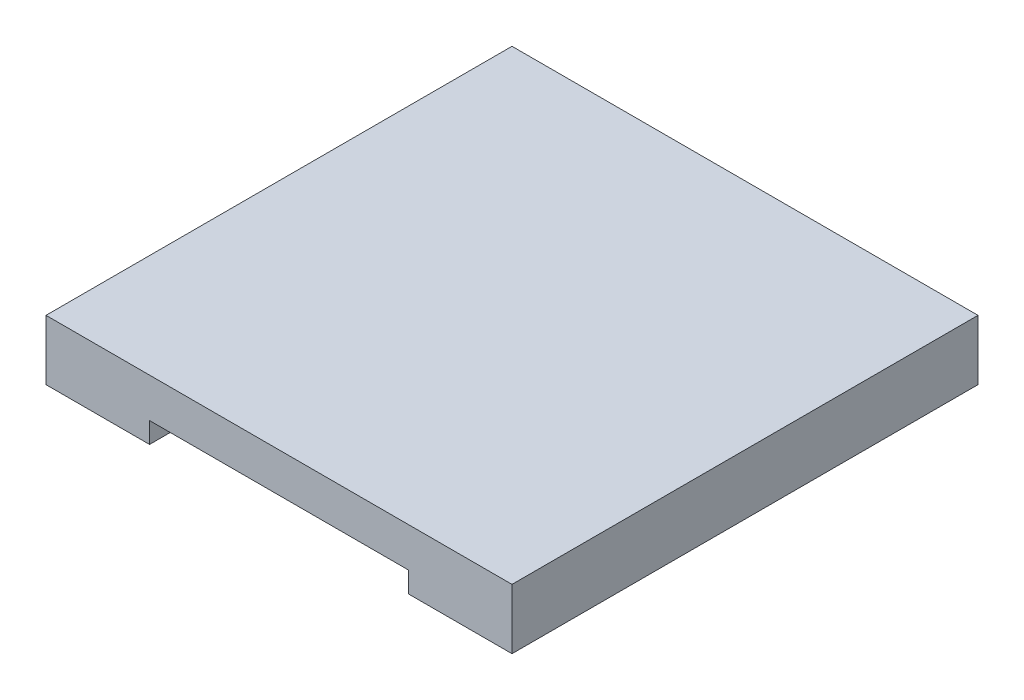
from build123d import *
from OCP.BRepFilletAPI import BRepFilletAPI_MakeChamfer

# Parameters (mm, degrees)
ESQUISSE2_W             = 90
ESQUISSE2_H             = 90
BOSS_EXTRU_1_DEPTH      = 4
ESQUISSE3_W             = 9.2
ESQUISSE3_H             = 10.3
BOSS_EXTRU_2_DEPTH      = 2.4
CONG_1_R                = 1
ESQUISSE5_W             = 14.85
ESQUISSE5_H             = 90
BOSS_EXTRU_3_DEPTH      = 2.4
ESQUISSE6_W             = 7
ESQUISSE6_H             = 5
BOSS_EXTRU_4_DEPTH      = 38
ESQUISSE8_W             = 14.85
ESQUISSE8_H             = 18
BOSS_EXTRU_5_DEPTH      = 38
BOSS_EXTRU_6_REACH      = 97.814
ESQUISSE9_W             = 7
ESQUISSE9_H             = 2
CONG_1_OF_SYM_TRIE1_R   = 1
ENL_V_MAT_EXTRU_1_REACH = 111.983
ESQUISSE10_W            = 2
ESQUISSE10_H            = 18
ENL_V_MAT_EXTRU_2_REACH = 77.38
ESQUISSE11_W            = 40
ESQUISSE11_H            = 18
ESQUISSE12_W            = 5
ESQUISSE12_H            = 8.6
BOSS_EXTRU_7_DEPTH      = 60.3
ESQUISSE13_W            = 6.9
ESQUISSE13_H            = 7.6
BOSS_EXTRU_8_DEPTH      = 2.45
CONG_2_R                = 1
CONG_2_OF_SYM_TRIE2_R   = 1
BOSS_EXTRU_9_DEPTH      = 3
BOSS_EXTRU_9_DEPTH_BACK = 3
ESQUISSE14_W            = 90
ESQUISSE14_H            = 17.8
ESQUISSE15_W            = 15
ESQUISSE15_H            = 17.8
BOSS_EXTRU_10_DEPTH     = 44
ESQUISSE16_W            = 90
ESQUISSE16_H            = 90
BOSS_EXTRU_11_DEPTH     = 11.6
ESQUISSE20_W            = 12
ESQUISSE20_H            = 6.4
BOSS_EXTRU_13_DEPTH     = 10
ESQUISSE21_W            = 12
ESQUISSE21_H            = 6.4
BOSS_EXTRU_14_DEPTH     = 10
CONG_3_R                = 6
ENL_V_MAT_EXTRU_4_REACH = 126.022
ESQUISSE23_R            = 2.3
CONG_3_OF_SYM_TRIE3_R   = 6
ENL_V_MAT_EXTRU_5_REACH = 126.022
ESQUISSE24_R            = 1.75
ENL_V_MAT_EXTRU_6_REACH = 137.909
ESQUISSE26_R            = 1.75
ESQUISSE27_W            = 50
ESQUISSE27_H            = 4
ENL_V_MAT_EXTRU_7_DEPTH = 72.2
CHANFREIN3_SIZE         = 28.5
CHANFREIN3_SIZE2        = 9.5
CHANFREIN4_SIZE         = 10
CHANFREIN4_SIZE2        = 17.5
CHANFREIN8_START        = -45
CHANFREIN8_DEPTH        = 17.8
CHANFREIN9_SIZE         = 3
CHANFREIN9_SIZE_2       = 9
CHANFREIN10_START       = 25.930676813
CHANFREIN10_OUTLINE_W   = 40
CHANFREIN10_OUTLINE_H   = 3.16227766
CHANFREIN10_DEPTH       = 2.069323187
CONG_9_R                = 3
ESQUISSE37_R            = 4
ENL_V_MAT_EXTRU_8_DEPTH = 3
BOSS_EXTRU_15_DEPTH     = 4.8
CONG_11_R               = 3
CHANFREIN14_SIZE        = 10
CHANFREIN14_SIZE2       = 5
ESQUISSE39_W            = 110.537037217
ESQUISSE39_H            = 103.424550411
ENL_V_MAT_EXTRU_9_DEPTH = 79
ESQUISSE40_W            = 8.2
ESQUISSE40_H            = 11.3
BOSS_EXTRU_16_DEPTH     = 15


with BuildPart() as part:
    # Esquisse2 → Boss.-Extru.1 (new body)
    with BuildSketch(Plane(origin=(0, 0, 0), x_dir=(1, 0, 0), z_dir=(0, 1, 0))):
        Rectangle(ESQUISSE2_W, ESQUISSE2_H)
    extrude(amount=BOSS_EXTRU_1_DEPTH)

    # Esquisse3 → Boss.-Extru.2 (add)
    with BuildSketch(Plane(origin=(0, 4, 0), x_dir=(1, 0, 0), z_dir=(0, 1, 0))):
        with Locations((25.55, -6)):
            Rectangle(ESQUISSE3_W, ESQUISSE3_H)
    boss_extru_2 = extrude(amount=BOSS_EXTRU_2_DEPTH)

    # Congé1
    cong_1_edges = [part.edges().sort_by_distance(p)[0] for p in [
        (20.95, 5.2, 0.85),
        (20.95, 5.2, 11.15),
    ]]
    fillet(cong_1_edges, radius=CONG_1_R)

    # Esquisse5 → Boss.-Extru.3 (add)
    with BuildSketch(Plane(origin=(0, 4, 0), x_dir=(1, 0, 0), z_dir=(0, 1, 0))):
        with Locations((37.575, 0)):
            Rectangle(ESQUISSE5_W, ESQUISSE5_H)
    boss_extru_3 = extrude(amount=BOSS_EXTRU_3_DEPTH)

    # Esquisse6 → Boss.-Extru.4 (add)
    with BuildSketch(Plane(origin=(0, 6.4, 0), x_dir=(1, 0, 0), z_dir=(0, 1, 0))):
        with Locations((33.65, -42.5)):
            Rectangle(ESQUISSE6_W, ESQUISSE6_H)
    boss_extru_4 = extrude(amount=BOSS_EXTRU_4_DEPTH)

    # Esquisse8 → Boss.-Extru.5 (add)
    with BuildSketch(Plane(origin=(0, 6.4, 0), x_dir=(1, 0, 0), z_dir=(0, 1, 0))):
        with Locations((37.575, 36)):
            Rectangle(ESQUISSE8_W, ESQUISSE8_H)
    boss_extru_5 = extrude(amount=BOSS_EXTRU_5_DEPTH)

    # Esquisse9 → Boss.-Extru.6 (add, up to next)
    with BuildSketch(Plane.XY.offset(-27), mode=Mode.PRIVATE) as boss_extru_6_sk1:
        with Locations((33.65, 43.4)):
            Rectangle(ESQUISSE9_W, ESQUISSE9_H)
    boss_extru_6_tool1 = extrude(boss_extru_6_sk1.sketch, amount=BOSS_EXTRU_6_REACH, mode=Mode.PRIVATE) - part.part
    boss_extru_6 = boss_extru_6_tool1.solids().sort_by_distance((33.65, 43.4, -27))[0]
    add(boss_extru_6)

    # Symétrie1: Boss.-Extru.2, Boss.-Extru.3, Boss.-Extru.4, Boss.-Extru.5, Boss.-Extru.6 across plane
    add(boss_extru_2.mirror(Plane(origin=(0, 0, 0), x_dir=(0, 0, 1), z_dir=(1, 0, 0))))
    add(boss_extru_3.mirror(Plane(origin=(0, 0, 0), x_dir=(0, 0, 1), z_dir=(1, 0, 0))))
    add(boss_extru_4.mirror(Plane(origin=(0, 0, 0), x_dir=(0, 0, 1), z_dir=(1, 0, 0))))
    add(boss_extru_5.mirror(Plane(origin=(0, 0, 0), x_dir=(0, 0, 1), z_dir=(1, 0, 0))))
    add(boss_extru_6.mirror(Plane(origin=(0, 0, 0), x_dir=(0, 0, 1), z_dir=(1, 0, 0))))

    # Congé1 of Symétrie1
    cong_1_of_sym_trie1_edges = [part.edges().sort_by_distance(p)[0] for p in [
        (-20.95, 5.2, 0.85),
        (-20.95, 5.2, 11.15),
    ]]
    fillet(cong_1_of_sym_trie1_edges, radius=CONG_1_OF_SYM_TRIE1_R)

    # Esquisse10 → Enlèv. mat.-Extru.1 (cut, up to next)
    with BuildSketch(Plane.XY.offset(45), mode=Mode.PRIVATE) as enl_v_mat_extru_1_sk1:
        with Locations((-31.15, 26.85)):
            Rectangle(ESQUISSE10_W, ESQUISSE10_H)
    enl_v_mat_extru_1_tool1 = extrude(enl_v_mat_extru_1_sk1.sketch, amount=-ENL_V_MAT_EXTRU_1_REACH, mode=Mode.PRIVATE) & part.part
    add(enl_v_mat_extru_1_tool1.solids().sort_by_distance((-31.15, 26.85, 45))[0], mode=Mode.SUBTRACT)

    # Esquisse11 → Enlèv. mat.-Extru.2 (cut, up to next)
    with BuildSketch(Plane(origin=(0, 4, 0), x_dir=(1, 0, 0), z_dir=(0, 1, 0)), mode=Mode.PRIVATE) as enl_v_mat_extru_2_sk1:
        with Locations((0, 36)):
            Rectangle(ESQUISSE11_W, ESQUISSE11_H)
    enl_v_mat_extru_2_tool1 = extrude(enl_v_mat_extru_2_sk1.sketch, amount=-ENL_V_MAT_EXTRU_2_REACH, mode=Mode.PRIVATE) & part.part
    add(enl_v_mat_extru_2_tool1.solids().sort_by_distance((0, 4, -36))[0], mode=Mode.SUBTRACT)

    # Esquisse12 → Boss.-Extru.7 (add)
    with BuildSketch(Plane(origin=(-30.15, 0, 0), x_dir=(0, 0, -1), z_dir=(1, 0, 0))):
        with Locations((29.5, 29.34)):
            Rectangle(ESQUISSE12_W, ESQUISSE12_H)
    extrude(amount=BOSS_EXTRU_7_DEPTH)

    # Esquisse13 → Boss.-Extru.8 (add)
    with BuildSketch(Plane.XY.offset(-27)):
        with Locations((24.4, 29.84)):
            Rectangle(ESQUISSE13_W, ESQUISSE13_H)
    boss_extru_8 = extrude(amount=BOSS_EXTRU_8_DEPTH)

    # Congé2
    cong_2_edges = [part.edges().sort_by_distance(p)[0] for p in [
        (20.95, 33.64, -25.775),
        (20.95, 26.04, -25.775),
    ]]
    fillet(cong_2_edges, radius=CONG_2_R)

    # Symétrie2: Boss.-Extru.8 across plane
    add(boss_extru_8.mirror(Plane(origin=(0, 0, 0), x_dir=(0, 0, 1), z_dir=(1, 0, 0))))

    # Congé2 of Symétrie2
    cong_2_of_sym_trie2_edges = [part.edges().sort_by_distance(p)[0] for p in [
        (-20.95, 33.64, -25.775),
        (-20.95, 26.04, -25.775),
    ]]
    fillet(cong_2_of_sym_trie2_edges, radius=CONG_2_OF_SYM_TRIE2_R)

    # Esquisse14 → Boss.-Extru.9 (add, two sides: drawn at the far end of the back side and taken through both)
    with BuildSketch(Plane(origin=(0, 44.4, 0), x_dir=(1, 0, 0), z_dir=(0, 1, 0)).offset(-BOSS_EXTRU_9_DEPTH_BACK)):
        with Locations((0, 36.1)):
            Rectangle(ESQUISSE14_W, ESQUISSE14_H)
    extrude(amount=BOSS_EXTRU_9_DEPTH + BOSS_EXTRU_9_DEPTH_BACK)

    # Esquisse15 → Boss.-Extru.10 (add)
    with BuildSketch(Plane(origin=(0, 47.4, 0), x_dir=(1, 0, 0), z_dir=(0, 1, 0))):
        with Locations((0, 36.1)):
            Rectangle(ESQUISSE15_W, ESQUISSE15_H)
    extrude(amount=BOSS_EXTRU_10_DEPTH)

    # Esquisse16 → Boss.-Extru.11 (add)
    with BuildSketch(Plane(origin=(0, 91.4, 0), x_dir=(1, 0, 0), z_dir=(0, 1, 0))):
        Rectangle(ESQUISSE16_W, ESQUISSE16_H)
    extrude(amount=BOSS_EXTRU_11_DEPTH)

    # Esquisse20 → Boss.-Extru.13 (add)
    with BuildSketch(Plane(origin=(45, 0, 0), x_dir=(0, 0, -1), z_dir=(1, 0, 0))):
        with Locations((-11, 3.2)):
            Rectangle(ESQUISSE20_W, ESQUISSE20_H)
    boss_extru_13 = extrude(amount=BOSS_EXTRU_13_DEPTH)

    # Esquisse21 → Boss.-Extru.14 (add)
    with BuildSketch(Plane(origin=(0, 0, -45), x_dir=(-1, 0, 0), z_dir=(0, 0, -1))):
        with Locations((-39, 3.2)):
            Rectangle(ESQUISSE21_W, ESQUISSE21_H)
    boss_extru_14 = extrude(amount=BOSS_EXTRU_14_DEPTH)

    # Congé3
    cong_3_edges = [part.edges().sort_by_distance(p)[0] for p in [
        (33, 3.2, -55),
        (45, 3.2, -55),
        (55, 3.2, 5),
        (55, 3.2, 17),
    ]]
    fillet(cong_3_edges, radius=CONG_3_R - 0.0001)  # a hair under: the kernel refuses the full size

    # Esquisse23 → Enlèv. mat.-Extru.4 (cut, up to next)
    with BuildSketch(Plane(origin=(0, 6.4, 0), x_dir=(1, 0, 0), z_dir=(0, 1, 0)), mode=Mode.PRIVATE) as enl_v_mat_extru_4_sk1:
        with Locations(Location((50, -11, 0), (0, 0, 270))):
            Circle(ESQUISSE23_R)
    enl_v_mat_extru_4_tool1 = extrude(enl_v_mat_extru_4_sk1.sketch, amount=-ENL_V_MAT_EXTRU_4_REACH, mode=Mode.PRIVATE) & part.part
    # Esquisse23 → Enlèv. mat.-Extru.4 (cut, up to next)
    with BuildSketch(Plane(origin=(0, 6.4, 0), x_dir=(1, 0, 0), z_dir=(0, 1, 0)), mode=Mode.PRIVATE) as enl_v_mat_extru_4_sk2:
        with Locations(Location((39, 50, 0), (0, 0, 270))):
            Circle(ESQUISSE23_R)
    enl_v_mat_extru_4_tool2 = extrude(enl_v_mat_extru_4_sk2.sketch, amount=-ENL_V_MAT_EXTRU_4_REACH, mode=Mode.PRIVATE) & part.part
    enl_v_mat_extru_4_1 = enl_v_mat_extru_4_tool1.solids().sort_by_distance((50, 6.4, 11))[0]
    add(enl_v_mat_extru_4_1, mode=Mode.SUBTRACT)
    enl_v_mat_extru_4_2 = enl_v_mat_extru_4_tool2.solids().sort_by_distance((39, 6.4, -50))[0]
    add(enl_v_mat_extru_4_2, mode=Mode.SUBTRACT)
    enl_v_mat_extru_4 = enl_v_mat_extru_4_1 + enl_v_mat_extru_4_2  # Enlèv. mat.-Extru.4 as one shape, for the pattern or mirror that repeats it

    # Symétrie3: Boss.-Extru.13, Boss.-Extru.14, Enlèv. mat.-Extru.4 across plane
    add(boss_extru_13.mirror(Plane(origin=(0, 0, 0), x_dir=(0, 0, 1), z_dir=(1, 0, 0))))
    add(boss_extru_14.mirror(Plane(origin=(0, 0, 0), x_dir=(0, 0, 1), z_dir=(1, 0, 0))))
    add(enl_v_mat_extru_4.mirror(Plane(origin=(0, 0, 0), x_dir=(0, 0, 1), z_dir=(1, 0, 0))), mode=Mode.SUBTRACT)

    # Congé3 of Symétrie3
    cong_3_of_sym_trie3_edges = [part.edges().sort_by_distance(p)[0] for p in [
        (-33, 3.2, -55),
        (-45, 3.2, -55),
        (-55, 3.2, 5),
        (-55, 3.2, 17),
    ]]
    fillet(cong_3_of_sym_trie3_edges, radius=CONG_3_OF_SYM_TRIE3_R - 0.0001)  # a hair under: the kernel refuses the full size

    # Esquisse24 → Enlèv. mat.-Extru.5 (cut, up to next)
    with BuildSketch(Plane(origin=(0, 6.4, 0), x_dir=(1, 0, 0), z_dir=(0, 1, 0)), mode=Mode.PRIVATE) as enl_v_mat_extru_5_sk1:
        with Locations(Location((25.45, -6, 0), (0, 0, 270))):
            Circle(ESQUISSE24_R)
    enl_v_mat_extru_5_tool1 = extrude(enl_v_mat_extru_5_sk1.sketch, amount=-ENL_V_MAT_EXTRU_5_REACH, mode=Mode.PRIVATE) & part.part
    enl_v_mat_extru_5 = enl_v_mat_extru_5_tool1.solids().sort_by_distance((25.45, 6.4, 6))[0]
    add(enl_v_mat_extru_5, mode=Mode.SUBTRACT)

    # Esquisse26 → Enlèv. mat.-Extru.6 (cut, up to next)
    with BuildSketch(Plane.XY.offset(-24.55), mode=Mode.PRIVATE) as enl_v_mat_extru_6_sk1:
        with Locations((25.55, 28.44)):
            Circle(ESQUISSE26_R)
    enl_v_mat_extru_6_tool1 = extrude(enl_v_mat_extru_6_sk1.sketch, amount=-ENL_V_MAT_EXTRU_6_REACH, mode=Mode.PRIVATE) & part.part
    enl_v_mat_extru_6 = enl_v_mat_extru_6_tool1.solids().sort_by_distance((25.55, 28.44, -24.55))[0]
    add(enl_v_mat_extru_6, mode=Mode.SUBTRACT)

    # Symétrie5: Enlèv. mat.-Extru.5, Enlèv. mat.-Extru.6 across plane
    add(enl_v_mat_extru_5.mirror(Plane(origin=(0, 0, 0), x_dir=(0, 0, 1), z_dir=(1, 0, 0))), mode=Mode.SUBTRACT)
    add(enl_v_mat_extru_6.mirror(Plane(origin=(0, 0, 0), x_dir=(0, 0, 1), z_dir=(1, 0, 0))), mode=Mode.SUBTRACT)

    # Esquisse27 → Enlèv. mat.-Extru.7 (cut)
    with BuildSketch(Plane.XY.offset(45)):
        with Locations((0, 93.4)):
            Rectangle(ESQUISSE27_W, ESQUISSE27_H)
    extrude(amount=-ENL_V_MAT_EXTRU_7_DEPTH, mode=Mode.SUBTRACT)

    # Chanfrein3: one chamfer whose edges measure the first distance from different faces: ONE call of the kernel's chamfer builder (chamfer() names one face for all edges)
    chanfrein3_edges_1 = [part.edges().sort_by_distance(p)[0] for p in [
        (-7.5, 47.4, -36.1),
    ]]
    chanfrein3_side_1 = [part.faces().sort_by_distance(p)[0] for p in [
        (-26.25, 47.4, -36.1),
    ]]
    chanfrein3_edges_2 = [part.edges().sort_by_distance(p)[0] for p in [
        (7.5, 47.4, -36.1),
    ]]
    chanfrein3_side_2 = [part.faces().sort_by_distance(p)[0] for p in [
        (26.25, 47.4, -36.1),
    ]]
    chanfrein3 = BRepFilletAPI_MakeChamfer(part.part.solid().wrapped)
    for e in chanfrein3_edges_1:
        chanfrein3.Add(CHANFREIN3_SIZE, CHANFREIN3_SIZE2, e.wrapped, chanfrein3_side_1[0].wrapped)  # the first distance lies on this face
    for e in chanfrein3_edges_2:
        chanfrein3.Add(CHANFREIN3_SIZE, CHANFREIN3_SIZE2, e.wrapped, chanfrein3_side_2[0].wrapped)  # the first distance lies on this face
    add(Compound.cast(chanfrein3.Shape()), mode=Mode.REPLACE)

    # Chanfrein4: one chamfer whose edges measure the first distance from different faces: ONE call of the kernel's chamfer builder (chamfer() names one face for all edges)
    chanfrein4_edges_1 = [part.edges().sort_by_distance(p)[0] for p in [
        (7.5, 91.4, -36.1),
    ]]
    chanfrein4_side_1 = [part.faces().sort_by_distance(p)[0] for p in [
        (7.5, 74.15, -36.1),
    ]]
    chanfrein4_edges_2 = [part.edges().sort_by_distance(p)[0] for p in [
        (-7.5, 91.4, -36.1),
    ]]
    chanfrein4_side_2 = [part.faces().sort_by_distance(p)[0] for p in [
        (-7.5, 74.15, -36.1),
    ]]
    chanfrein4 = BRepFilletAPI_MakeChamfer(part.part.solid().wrapped)
    for e in chanfrein4_edges_1:
        chanfrein4.Add(CHANFREIN4_SIZE, CHANFREIN4_SIZE2, e.wrapped, chanfrein4_side_1[0].wrapped)  # the first distance lies on this face
    for e in chanfrein4_edges_2:
        chanfrein4.Add(CHANFREIN4_SIZE, CHANFREIN4_SIZE2, e.wrapped, chanfrein4_side_2[0].wrapped)  # the first distance lies on this face
    add(Compound.cast(chanfrein4.Shape()), mode=Mode.REPLACE)

    # Chanfrein8: read off the stored shape, not the designer's step
    # Chanfrein8 outline → Chanfrein8 (add)
    with BuildSketch(Plane.XY.offset(CHANFREIN8_START)):
        Polygon((30.15, 31.35), (30.15, 41.4), (0, 41.4), align=None)
    extrude(amount=CHANFREIN8_DEPTH)

    # Chanfrein9
    chanfrein9_edges_1 = [part.edges().sort_by_distance(p)[0] for p in [
        (45, 47.4, -36.1),
    ]]
    chanfrein9_side_1 = [part.faces().sort_by_distance(p)[0] for p in [
        (45, 47.34, -36.1),
    ]]
    chanfrein9_edges_2 = [part.edges().sort_by_distance(p)[0] for p in [
        (-45, 47.4, -36.1),
    ]]
    chanfrein9_side_2 = [part.faces().sort_by_distance(p)[0] for p in [
        (-44.94, 47.4, -36.1),
    ]]
    chanfrein9 = BRepFilletAPI_MakeChamfer(part.part.solid().wrapped)
    for e in chanfrein9_edges_1:
        chanfrein9.Add(CHANFREIN9_SIZE - 0.0001, CHANFREIN9_SIZE_2 - 0.0001, e.wrapped, chanfrein9_side_1[0].wrapped)
    for e in chanfrein9_edges_2:
        chanfrein9.Add(CHANFREIN9_SIZE_2 - 0.0001, CHANFREIN9_SIZE - 0.0001, e.wrapped, chanfrein9_side_2[0].wrapped)
    add(Compound.cast(chanfrein9.Shape()), mode=Mode.REPLACE)  # a hair under: the kernel refuses the full size

    # Chanfrein10: read off the stored shape, not the designer's step
    # Chanfrein10 outline → Chanfrein10 (cut)
    with BuildSketch(Plane(origin=(0, 0, 0), x_dir=(1, 0, 0), z_dir=(0, 0.31622776601683705, -0.9486832980505141)).offset(CHANFREIN10_START)):
        with Locations((0, 6.008327554)):
            Rectangle(CHANFREIN10_OUTLINE_W, CHANFREIN10_OUTLINE_H)
    extrude(amount=CHANFREIN10_DEPTH, mode=Mode.SUBTRACT)

    # Congé9
    cong_9_edges = [part.edges().sort_by_distance(p)[0] for p in [
        (-33.65, 44.4, 45),
        (-33.65, 6.4, 40),
        (-37.575, 6.4, -27),
        (-33.65, 42.4, 40),
        (-33.65, 42.4, -27),
        (33.65, 6.4, 40),
        (33.65, 44.4, 45),
        (37.575, 6.4, -27),
        (33.65, 42.4, 40),
        (33.65, 42.4, -27),
    ]]
    fillet(cong_9_edges, radius=CONG_9_R)

    # Chanfrein13
    # the kernel refuses this chamfer: 31.5, 10.5 mm, written as the material it adds along each edge
    with BuildSketch(Plane(origin=(-30.15, 41.4, -27.2), x_dir=(0, -1, 0), z_dir=(0, 0, -1))) as chanfrein13_piece_1:
        with BuildLine():
            Line((10.898446985, 1.195340956), (-0.398446985, -32.695340956))
            Line((-0.398446985, -32.695340956), (-1.028446985, -32.695340956))
            ThreePointArc((-1.028446985, -32.695340956), (-0.63, -16.347670478), (-0.63, 0))
            Line((-0.63, 0), (0, 0.63))
            ThreePointArc((0, 0.63), (5.449223493, 0.63), (10.898446985, 1.825340956))
            Line((10.898446985, 1.825340956), (10.898446985, 1.195340956))
        make_face()
    extrude(amount=17.8)

    # Esquisse37 → Enlèv. mat.-Extru.8 (cut)
    with BuildSketch(Plane.XZ):
        with Locations(Location((-25.45, 6, 0), (0, 0, 270))):
            Circle(ESQUISSE37_R)
        with Locations(Location((25.45, 6, 0), (0, 0, 270))):
            Circle(ESQUISSE37_R)
    extrude(amount=-ENL_V_MAT_EXTRU_8_DEPTH, mode=Mode.SUBTRACT)

    # Esquisse38 → Boss.-Extru.15 (add)
    with BuildSketch(Plane.XY.offset(-27.2)):
        Polygon((0.675, 41.175), (-21.95, 33.64), (23.28, 33.64), align=None)
    extrude(amount=-BOSS_EXTRU_15_DEPTH)

    # Congé11
    cong_11_edges = [part.edges().sort_by_distance(p)[0] for p in [
        (7.5, 56.9, -36.1),
        (-7.5, 56.9, -36.1),
        (-25, 91.4, -36.1),
        (-7.5, 81.4, -36.1),
        (25, 91.4, -36.1),
        (7.5, 81.4, -36.1),
        (30.15, 31.35, -38.5),
        (-30.15, 30.9, -38.5),
        (0.675, 41.175, -38.5),
    ]]
    fillet(cong_11_edges, radius=CONG_11_R)

    # Chanfrein14
    chanfrein14_edges = [part.edges().sort_by_distance(p)[0] for p in [
        (0, 95.4, -27.2),
    ]]
    chanfrein14_side = [part.faces().sort_by_distance(p)[0] for p in [
        (0, 95.4, 8.9),
    ]]
    chamfer(chanfrein14_edges, length=CHANFREIN14_SIZE, length2=CHANFREIN14_SIZE2, reference=chanfrein14_side[0])

    # Esquisse39 → Enlèv. mat.-Extru.9 (cut)
    with BuildSketch(Plane.XZ):
        with Locations((-0.268518609, -4.614943927)):
            Rectangle(ESQUISSE39_W, ESQUISSE39_H)
    extrude(amount=-ENL_V_MAT_EXTRU_9_DEPTH, mode=Mode.SUBTRACT)

    # Esquisse40 → Boss.-Extru.16 (add)
    with BuildSketch(Plane.XZ.offset(-79)):
        with Locations((0, -36.1)):
            Rectangle(ESQUISSE40_W, ESQUISSE40_H)
    extrude(amount=BOSS_EXTRU_16_DEPTH)


solid = part.part
